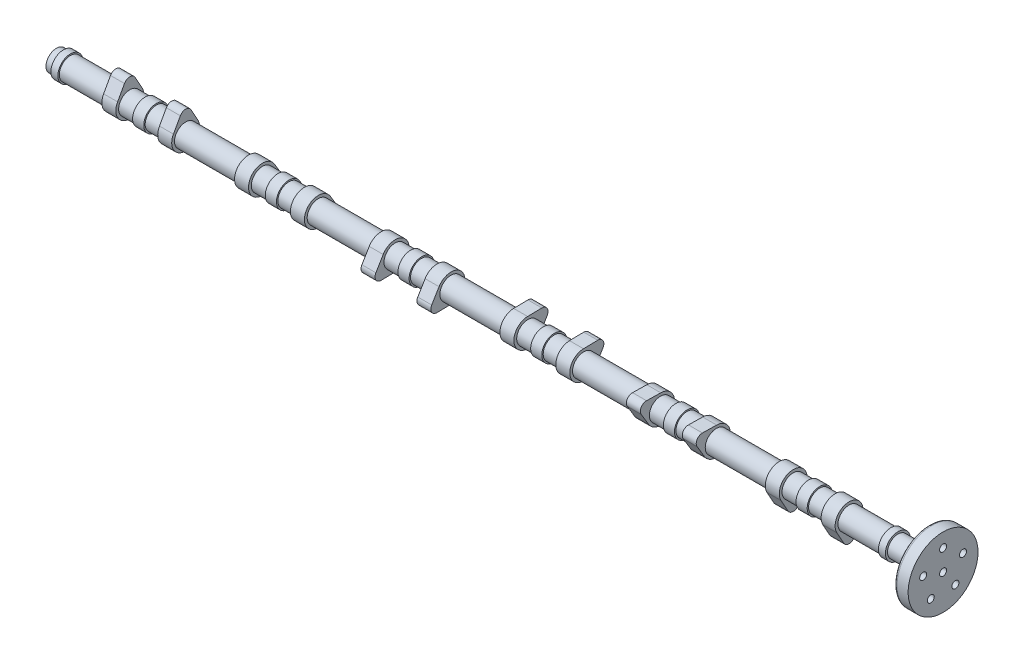
from build123d import *

# Parameters (mm, degrees)
SKETCH1_R             = 8
BOSS_EXTRUDE1_DEPTH   = 47.5
BOSS_EXTRUDE2_START   = 15
BOSS_EXTRUDE2_DEPTH   = 10
SKETCH3_R             = 9
BOSS_EXTRUDE3_DEPTH   = 4
LPATTERN1_COUNT       = 6
LPATTERN1_PITCH       = 95
BODY_MOVE_COPY1_ANGLE = 60
BODY_MOVE_COPY2_ANGLE = 120
BODY_MOVE_COPY3_ANGLE = 60
BODY_MOVE_COPY4_ANGLE = 120
BODY_MOVE_COPY5_ANGLE = 180
SKETCH4_R             = 8
BOSS_EXTRUDE4_DEPTH   = 10
SKETCH5_R             = 9
BOSS_EXTRUDE5_DEPTH   = 5
SKETCH6_R             = 7.5
BOSS_EXTRUDE6_DEPTH   = 5
SKETCH7_R             = 8
BOSS_EXTRUDE7_DEPTH   = 7.5
SKETCH8_R             = 9
BOSS_EXTRUDE8_DEPTH   = 5
SKETCH9_R             = 7.5
BOSS_EXTRUDE9_DEPTH   = 22.3
SKETCH10_R            = 25
SKETCH10_R_2          = 2.5
BOSS_EXTRUDE10_DEPTH  = 10
SKETCH11_R            = 2.5
CUT_EXTRUDE1_DEPTH    = 15
FILLET1_R             = 2


with BuildPart() as part:
    # Sketch1 → Boss-Extrude1 (new, symmetric)
    with BuildSketch(Plane(origin=(0, 0, 0), x_dir=(0, 0, -1), z_dir=(1, 0, 0))):
        Circle(SKETCH1_R)
    extrude(amount=BOSS_EXTRUDE1_DEPTH, both=True)

    # Sketch2 → Boss-Extrude2 (add)
    with BuildSketch(Plane(origin=(0, 0, 0), x_dir=(0, 0, -1), z_dir=(1, 0, 0)).offset(BOSS_EXTRUDE2_START)):
        with BuildLine():
            Line((-8.746197071, -4.848096202), (-3.807936598, -13.756953924))
            ThreePointArc((-3.807936598, -13.756953924), (0, -16), (3.807936598, -13.756953924))
            Line((3.807936598, -13.756953924), (8.746197071, -4.848096202))
            ThreePointArc((8.746197071, -4.848096202), (0, 10), (-8.746197071, -4.848096202))
        make_face()
    boss_extrude2 = extrude(amount=BOSS_EXTRUDE2_DEPTH)

    # Mirror1: Boss-Extrude2 across plane
    add(boss_extrude2.mirror(Plane(origin=(0, 0, 0), x_dir=(0, 0, 1), z_dir=(1, 0, 0))))

    # Sketch3 → Boss-Extrude3 (add, symmetric)
    with BuildSketch(Plane(origin=(0, 0, 0), x_dir=(0, 0, -1), z_dir=(1, 0, 0))):
        Circle(SKETCH3_R)
    extrude(amount=BOSS_EXTRUDE3_DEPTH, both=True)


with BuildPart() as lpattern1_1:
    # LPattern1: pattern copy
    add(part.part.moved(Location(Vector(-1, 0, 0) * (1 * LPATTERN1_PITCH))))


with BuildPart() as lpattern1_2:
    # LPattern1: pattern copy
    add(part.part.moved(Location(Vector(-1, 0, 0) * (2 * LPATTERN1_PITCH))))


with BuildPart() as lpattern1_3:
    # LPattern1: pattern copy
    add(part.part.moved(Location(Vector(-1, 0, 0) * (3 * LPATTERN1_PITCH))))


with BuildPart() as lpattern1_4:
    # LPattern1: pattern copy
    add(part.part.moved(Location(Vector(-1, 0, 0) * (4 * LPATTERN1_PITCH))))


with BuildPart() as lpattern1_5:
    # LPattern1: pattern copy
    add(part.part.moved(Location(Vector(-1, 0, 0) * (5 * LPATTERN1_PITCH))))


with BuildPart() as lpattern1_3_1:
    # Body-Move/Copy1: moved
    add(lpattern1_3.part.rotate(Axis((0, 0, 0), (-1, 0, 0)), BODY_MOVE_COPY1_ANGLE))


with BuildPart() as lpattern1_1_1:
    # Body-Move/Copy2: moved
    add(lpattern1_1.part.rotate(Axis((0, 0, 0), (-1, 0, 0)), BODY_MOVE_COPY2_ANGLE))


with BuildPart() as lpattern1_4_1:
    # Body-Move/Copy3: moved
    add(lpattern1_4.part.rotate(Axis((0, 0, 0), (1, 0, 0)), BODY_MOVE_COPY3_ANGLE))


with BuildPart() as lpattern1_2_1:
    # Body-Move/Copy4: moved
    add(lpattern1_2.part.rotate(Axis((0, 0, 0), (1, 0, 0)), BODY_MOVE_COPY4_ANGLE))


with BuildPart() as lpattern1_5_1:
    # Body-Move/Copy5: moved
    add(lpattern1_5.part.rotate(Axis((0, 0, 0), (1, 0, 0)), BODY_MOVE_COPY5_ANGLE))

    # Sketch4 → Boss-Extrude4 (add)
    with BuildSketch(Plane.ZY.offset(522.5)):
        Circle(SKETCH4_R)
    extrude(amount=BOSS_EXTRUDE4_DEPTH)

    # Sketch5 → Boss-Extrude5 (add)
    with BuildSketch(Plane.ZY.offset(532.5)):
        Circle(SKETCH5_R)
    extrude(amount=BOSS_EXTRUDE5_DEPTH)


with BuildPart() as lpattern1_4_2:
    add(lpattern1_4_1.part)

    # Combine1: union LPattern1_1, LPattern1_3, LPattern1_2, part, LPattern1_5
    add(lpattern1_1_1.part)
    add(lpattern1_3_1.part)
    add(lpattern1_2_1.part)
    add(part.part)
    add(lpattern1_5_1.part)

    # Sketch6 → Boss-Extrude6 (add)
    with BuildSketch(Plane.ZY.offset(537.5)):
        Circle(SKETCH6_R)
    extrude(amount=BOSS_EXTRUDE6_DEPTH)

    # Sketch7 → Boss-Extrude7 (add)
    with BuildSketch(Plane(origin=(47.5, 0, 0), x_dir=(0, 0, -1), z_dir=(1, 0, 0))):
        Circle(SKETCH7_R)
    extrude(amount=BOSS_EXTRUDE7_DEPTH)

    # Sketch8 → Boss-Extrude8 (add)
    with BuildSketch(Plane(origin=(55, 0, 0), x_dir=(0, 0, -1), z_dir=(1, 0, 0))):
        Circle(SKETCH8_R)
    extrude(amount=BOSS_EXTRUDE8_DEPTH)

    # Sketch9 → Boss-Extrude9 (add)
    with BuildSketch(Plane(origin=(60, 0, 0), x_dir=(0, 0, -1), z_dir=(1, 0, 0))):
        Circle(SKETCH9_R)
    extrude(amount=BOSS_EXTRUDE9_DEPTH)

    # Sketch10 → Boss-Extrude10 (add)
    with BuildSketch(Plane(origin=(82.3, 0, 0), x_dir=(0, 0, -1), z_dir=(1, 0, 0))):
        Circle(SKETCH10_R)
        Circle(SKETCH10_R_2, mode=Mode.SUBTRACT)
    extrude(amount=BOSS_EXTRUDE10_DEPTH)

    # Sketch11 → Cut-Extrude1 (cut)
    with BuildSketch(Plane(origin=(92.3, 0, 0), x_dir=(0, 0, -1), z_dir=(1, 0, 0))):
        with Locations((0, 15)):
            Circle(SKETCH11_R)
        Circle(SKETCH11_R)
        with Locations((14.265847744, 4.635254916)):
            Circle(SKETCH11_R)
        with Locations((8.816778784, -12.135254916)):
            Circle(SKETCH11_R)
        with Locations((-8.816778784, -12.135254916)):
            Circle(SKETCH11_R)
        with Locations((-14.265847744, 4.635254916)):
            Circle(SKETCH11_R)
    extrude(amount=-CUT_EXTRUDE1_DEPTH, mode=Mode.SUBTRACT)

    # Fillet1
    fillet1_edges = [lpattern1_4_2.edges().sort_by_distance(p)[0] for p in [
        (82.3, 0, 25),
        (82.3, 0, 7.5),
    ]]
    fillet(fillet1_edges, radius=FILLET1_R)


solid = lpattern1_4_2.part
